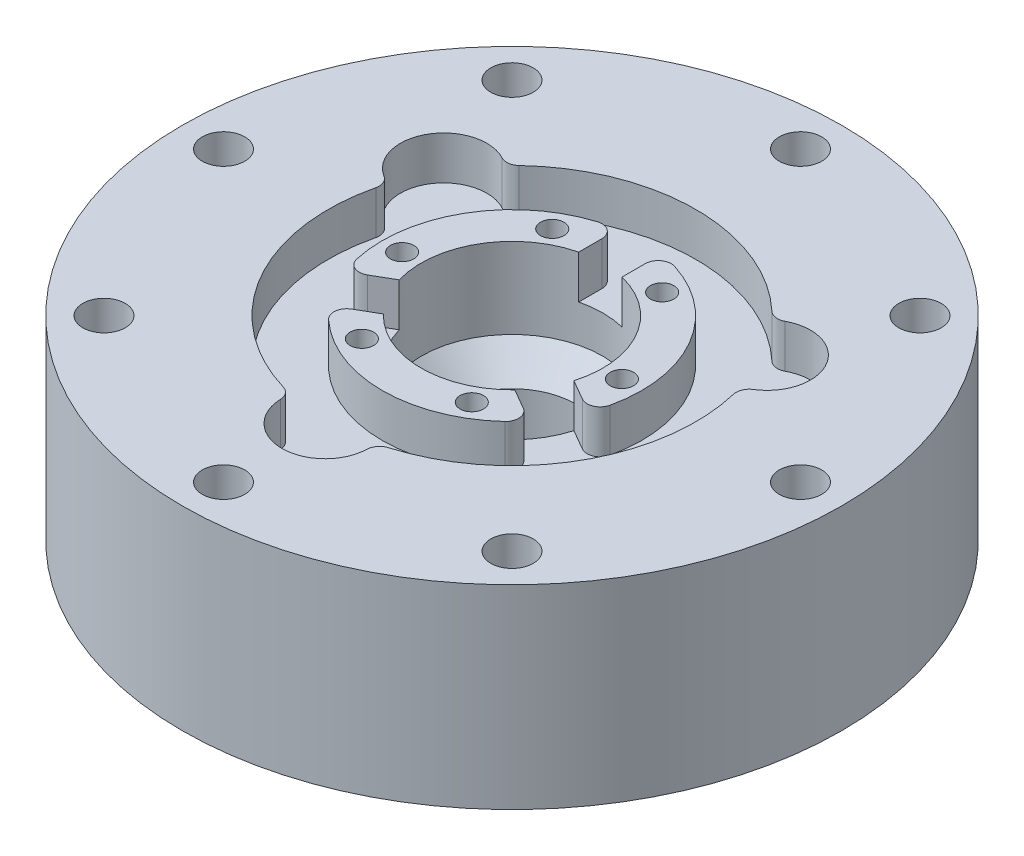
from build123d import *

# Parameters (mm, degrees)
SKETCH6_R                   = 42.5
SKETCH6_R_2                 = 29
CUT_EXTRUDE3_DEPTH          = 10
CUT_EXTRUDE4_DEPTH          = 10
CIRPATTERN2_COUNT           = 3
DELETEFACE1_START           = 15
DELETEFACE1_OUTLINE_R       = 76.2
DELETEFACE1_OUTLINE_R_2     = 55
DELETEFACE1_DEPTH           = 20
F_3_8_CLEARANCE_HOLE1_D     = 9.8044
SKETCH46_R                  = 10.000000000000007
CUT_EXTRUDE5_DEPTH          = 10
CIRPATTERN6_COUNT           = 3
SKETCH54_R                  = 57.5945
SKETCH54_R_2                = 55.56250000000001
CUT_EXTRUDE6_DEPTH          = 1.27
MOVE_START                  = 16.3599999
MOVE_FACE1_DEPTH            = 18.6400001
MOVE_FACE1_2_DEPTH          = 8.6400001
F_1_4_28_TAPPED_HOLE1_D     = 5.4102
F_1_4_28_TAPPED_HOLE1_DEPTH = 15.42
F_1_4_28_TAPPED_HOLE1_TIP   = 1.6253880605314532
FILLET2_R                   = 3


# Read off the part's stored shape, not the designer's step: DeleteFace1, Move Face1
with BuildPart() as part:
    # Sketch3 → Revolve1 (revolve)
    with BuildSketch(Plane(origin=(0, 0, 0), x_dir=(0, 0, -1), z_dir=(1, 0, 0))):
        with BuildLine():
            Line((76.2, 15.000000000000002), (55, 14.999999999999998))
            Line((55, 14.999999999999998), (55, 34.99999999999999))
            Line((55, 34.99999999999999), (22.024999999999995, 34.99999999999999))
            Line((22.024999999999995, 34.99999999999999), (22.024999999999995, 17.360000000000028))
            Line((22.024999999999995, 17.360000000000028), (14.665, 10))
            Line((14.665, 10), (14.665, 0))
            Line((14.665, 0), (19.665, 0))
            ThreePointArc((19.665, 0), (38.73875508023388, 1.7729204917795123), (53.85, -10.000000000000004))
            Line((53.85, -10.000000000000004), (76.2, -10))
            Line((76.2, -10), (76.2, 15.000000000000002))
        make_face()
    revolve(axis=Axis((0, 0, 0), (0, 1, 0)))

    # Sketch6 → Cut-Extrude3 (cut)
    with BuildSketch(Plane(origin=(0, 34.99999999999999, 0), x_dir=(1, 0, 0), z_dir=(0, 1, 0))):
        with Locations(Location((0, 0, 0), (0, 0, 270))):
            Circle(SKETCH6_R)
        with Locations(Location((0, 0, 0), (0, 0, 270))):
            Circle(SKETCH6_R_2, mode=Mode.SUBTRACT)
    extrude(amount=-CUT_EXTRUDE3_DEPTH, mode=Mode.SUBTRACT)

    # Sketch7 → Cut-Extrude4 (cut)
    with BuildSketch(Plane(origin=(0, 34.99999999999999, 0), x_dir=(1, 0, 0), z_dir=(0, 1, 0))):
        Polygon((-4.999999999999999, 29), (5.000000000000001, 29.000000000000004), (5.000000000000005, 21.44995629366177), (-5, 21.449956293661767), align=None)
    cut_extrude4 = extrude(amount=-CUT_EXTRUDE4_DEPTH, mode=Mode.SUBTRACT)

    # CirPattern2: Cut-Extrude4 ×3 about axis
    cirpattern2_axis = Axis((2.9e-16, 0, 0), (0, 1, 0))
    for i in range(1, CIRPATTERN2_COUNT):
        add(cut_extrude4.rotate(cirpattern2_axis, i * 360 / CIRPATTERN2_COUNT), mode=Mode.SUBTRACT)

    # DeleteFace1 outline → DeleteFace1 (add)
    with BuildSketch(Plane(origin=(0, 0, 0), x_dir=(1, 0, 0), z_dir=(0, 1, 0)).offset(DELETEFACE1_START)):
        Circle(DELETEFACE1_OUTLINE_R)
        Circle(DELETEFACE1_OUTLINE_R_2, mode=Mode.SUBTRACT)
    extrude(amount=DELETEFACE1_DEPTH)

    # 3/8 Clearance Hole1 (through all)
    with Locations(Plane(origin=(0, -10.000000000000002, 0), x_dir=(-1, 0, 0), z_dir=(0, -1, 0))):
        with Locations((-47.146344636, 47.146344636), (-66.675, 0), (-47.146344636, -47.146344636), (0, -66.675), (47.146344636, -47.146344636), (66.675, 0), (47.146344636, 47.146344636), (0, 66.675)):
            Hole(F_3_8_CLEARANCE_HOLE1_D / 2)

    # Sketch46 → Cut-Extrude5 (cut)
    with BuildSketch(Plane(origin=(0, 34.99999999999999, 0), x_dir=(1, 0, 0), z_dir=(0, 1, 0))):
        with Locations((0, -43.17999999999999)):
            Circle(SKETCH46_R)
    cut_extrude5 = extrude(amount=-CUT_EXTRUDE5_DEPTH, mode=Mode.SUBTRACT)

    # CirPattern6: Cut-Extrude5 ×3 about axis
    cirpattern6_axis = Axis((2.97e-15, 0, -2.87e-15), (0, 1, 0))
    for i in range(1, CIRPATTERN6_COUNT):
        add(cut_extrude5.rotate(cirpattern6_axis, i * 360 / CIRPATTERN6_COUNT), mode=Mode.SUBTRACT)

    # Sketch54 → Cut-Extrude6 (cut)
    with BuildSketch(Plane.XZ.offset(10.000000000000002)):
        with Locations(Location((1.9421e-13, 2e-17, 0), (0, 0, 270))):
            Circle(SKETCH54_R)
        with Locations(Location((1.9421e-13, 2e-17, 0), (0, 0, 270))):
            Circle(SKETCH54_R_2, mode=Mode.SUBTRACT)
    extrude(amount=-CUT_EXTRUDE6_DEPTH, mode=Mode.SUBTRACT)

    # Move Face1 outline → Move Face1 (add)
    with BuildSketch(Plane(origin=(0, 0, 0), x_dir=(1, 0, 0), z_dir=(0, 1, 0)).offset(MOVE_START)):
        with BuildLine():
            Line((27.238633754, -9.952729838), (28.117376915, -10.460072439))
            ThreePointArc((28.117376915, -10.460072439), (25.980762114, 15), (5, 29.580398915))
            Line((5, 29.580398915), (5, 28.565713714))
            ThreePointArc((5, 28.565713714), (25.11473671, 14.5), (27.238633754, -9.952729838))
        make_face()
        with BuildLine():
            Line((20.18581264, -5.88078167), (21.07620706, -6.394851128))
            ThreePointArc((21.07620706, -6.394851128), (19.074209518, 11.0125), (5, 21.449956294))
            Line((5, 21.449956294), (5, 20.421817378))
            ThreePointArc((5, 20.421817378), (18.208184115, 10.5125), (20.18581264, -5.88078167))
        make_face()
        with BuildLine():
            ThreePointArc((-16.07620706, -15.055105166), (0, -22.025), (16.07620706, -15.055105166))
            Line((16.07620706, -15.055105166), (15.18581264, -14.541035708))
            ThreePointArc((15.18581264, -14.541035708), (0, -21.025), (-15.18581264, -14.541035708))
            Line((-15.18581264, -14.541035708), (-16.07620706, -15.055105166))
        make_face()
        with BuildLine():
            Line((-5, 20.421817378), (-5, 21.449956294))
            ThreePointArc((-5, 21.449956294), (-19.074209518, 11.0125), (-21.07620706, -6.394851128))
            Line((-21.07620706, -6.394851128), (-20.18581264, -5.88078167))
            ThreePointArc((-20.18581264, -5.88078167), (-18.208184115, 10.5125), (-5, 20.421817378))
        make_face()
        with BuildLine():
            Line((23.117376915, -19.120326477), (22.238633754, -18.612983876))
            ThreePointArc((22.238633754, -18.612983876), (0, -29), (-22.238633754, -18.612983876))
            Line((-22.238633754, -18.612983876), (-23.117376915, -19.120326477))
            ThreePointArc((-23.117376915, -19.120326477), (0, -30), (23.117376915, -19.120326477))
        make_face()
        with BuildLine():
            ThreePointArc((-27.238633754, -9.952729838), (-25.11473671, 14.5), (-5, 28.565713714))
            Line((-5, 28.565713714), (-5, 29.580398915))
            ThreePointArc((-5, 29.580398915), (-25.980762114, 15), (-28.117376915, -10.460072439))
            Line((-28.117376915, -10.460072439), (-27.238633754, -9.952729838))
        make_face()
    extrude(amount=MOVE_FACE1_DEPTH)

    # Move Face1 2 outline → Move Face1 2 (add)
    with BuildSketch(Plane(origin=(0, 0, 0), x_dir=(1, 0, 0), z_dir=(0, 1, 0)).offset(MOVE_START)):
        with BuildLine():
            ThreePointArc((16.07620706, -15.055105166), (19.074209518, -11.0125), (21.07620706, -6.394851128))
            Line((21.07620706, -6.394851128), (20.18581264, -5.88078167))
            ThreePointArc((20.18581264, -5.88078167), (18.208184114, -10.5125), (15.18581264, -14.541035708))
            Line((15.18581264, -14.541035708), (16.07620706, -15.055105166))
        make_face()
        with BuildLine():
            Line((5, 20.421817378), (5, 21.449956294))
            ThreePointArc((5, 21.449956294), (0, 22.025), (-5, 21.449956294))
            Line((-5, 21.449956294), (-5, 20.421817378))
            ThreePointArc((-5, 20.421817378), (0, 21.025), (5, 20.421817378))
        make_face()
        with BuildLine():
            ThreePointArc((-21.07620706, -6.394851128), (-19.074209518, -11.0125), (-16.07620706, -15.055105166))
            Line((-16.07620706, -15.055105166), (-15.18581264, -14.541035708))
            ThreePointArc((-15.18581264, -14.541035708), (-18.208184114, -10.5125), (-20.18581264, -5.88078167))
            Line((-20.18581264, -5.88078167), (-21.07620706, -6.394851128))
        make_face()
    extrude(amount=MOVE_FACE1_2_DEPTH)

    # 1/4-28 Tapped Hole1
    with Locations(Plane(origin=(0, 34.99999999999999, 0), x_dir=(1, 0, 0), z_dir=(0, 1, 0))):
        with Locations((12.7, -21.997045256), (25.4, 0), (12.7, 21.997045256), (-12.7, 21.997045256), (-25.4, 0), (-12.7, -21.997045256)):
            Hole(F_1_4_28_TAPPED_HOLE1_D / 2, depth=F_1_4_28_TAPPED_HOLE1_DEPTH)
            with Locations((0, 0, -(F_1_4_28_TAPPED_HOLE1_DEPTH + F_1_4_28_TAPPED_HOLE1_TIP / 2))):  # 118° drill point
                Cone(0, F_1_4_28_TAPPED_HOLE1_D / 2, F_1_4_28_TAPPED_HOLE1_TIP, mode=Mode.SUBTRACT)

    # Fillet2
    # the kernel refuses this fillet: 3 mm, written as the material it takes off along each edge
    with BuildSketch(Plane(origin=(9.830646823307555, 24.999999999999993, 41.34741083835109), x_dir=(0.9660012872655641, 0, -0.2585372565052729), z_dir=(0, 1, 0))) as fillet2_piece_1:
        with BuildLine():
            CenterArc((2.4710993757232056, -2.99881698030462), FILLET2_R, 91.60911566596931, 71.53236669555653)
            ThreePointArc((-0.399972032548426, -2.1287888378832687), (-0.1421780421624502, -1.075255793490215), (0, 0))
            ThreePointArc((0, 0), (1.193428675775411, -0.0167594456845017), (2.386857351550826, 1e-16))
        make_face()
    extrude(amount=15.967143378877061, mode=Mode.SUBTRACT)
    with BuildSketch(Plane(origin=(-9.830646823307555, 24.999999999999993, 41.34741083835109), x_dir=(-0.9660012872655644, 0, -0.2585372565052715), z_dir=(0, 1, 0))) as fillet2_piece_2:
        with BuildLine():
            CenterArc((2.471099375723227, 2.9988169803046207), FILLET2_R, 196.85851763847407, 71.53236669555645)
            ThreePointArc((-0.3999720325484057, 2.1287888378832736), (-0.14217804216245042, 1.075255793490222), (0, 0))
            ThreePointArc((0, 0), (1.1934286757754193, 0.01675944568450221), (2.386857351550839, 2e-17))
        make_face()
    extrude(amount=15.967143378877097, mode=Mode.SUBTRACT)
    with BuildSketch(Plane(origin=(30.892584755070303, 24.999999999999993, -29.18729530379268), x_dir=(0.8256829754273846, 0, -0.5641344025047409), z_dir=(0, 1, 0))) as fillet2_piece_3:
        with BuildLine():
            CenterArc((2.490943414807226, 2.9823541557433946), FILLET2_R, 192.25019723269426, 71.53236669558856)
            ThreePointArc((-0.4407477133877039, 2.345811047334284), (-0.20390261981452568, 1.1760002571493982), (0, 0))
            ThreePointArc((0, 0), (1.0830188760031507, 0.05881948085535766), (2.1660377520062934, -7e-17))
        make_face()
    extrude(amount=15.967143378876976, mode=Mode.SUBTRACT)
    with BuildSketch(Plane(origin=(40.72323157837786, 24.999999999999993, -12.160115534558376), x_dir=(0.25910081167448135, 0, 0.9658502831130842), z_dir=(0, 1, 0))) as fillet2_piece_4:
        with BuildLine():
            CenterArc((2.471099375723175, 2.998816980304626), FILLET2_R, 196.85851763847427, 71.53236669555645)
            ThreePointArc((-0.39997203254845776, 2.1287888378832673), (-0.14217804216247343, 1.0752557934902138), (0, 0))
            ThreePointArc((0, 0), (1.1934286757754016, 0.01675944568450463), (2.3868573515507956, -2e-17))
        make_face()
    extrude(amount=15.96714337887699, mode=Mode.SUBTRACT)
    with BuildSketch(Plane(origin=(-40.72323157837785, 24.999999999999993, -12.160115534558436), x_dir=(-0.9013962114315556, 0, -0.43299523094006276), z_dir=(0, 1, 0))) as fillet2_piece_5:
        with BuildLine():
            CenterArc((2.49094341480725, 2.982354155743391), FILLET2_R, 192.2501972326937, 71.53236669558873)
            ThreePointArc((-0.4407477133876857, 2.3458110473343083), (-0.20390261981451535, 1.1760002571494013), (0, 0))
            ThreePointArc((0, 0), (1.0830188760031414, 0.0588194808553639), (2.1660377520062966, -6e-17))
        make_face()
    extrude(amount=15.967143378877033, mode=Mode.SUBTRACT)
    with BuildSketch(Plane(origin=(-30.892584755070274, 24.999999999999993, -29.187295303792705), x_dir=(0.7069004755910809, 0, -0.7073130266078123), z_dir=(0, 1, 0))) as fillet2_piece_6:
        with BuildLine():
            CenterArc((2.4710993757232096, 2.9988169803046243), FILLET2_R, 196.85851763847404, 71.53236669555645)
            ThreePointArc((-0.3999720325484262, 2.1287888378832767), (-0.14217804216245522, 1.0752557934902165), (0, 0))
            ThreePointArc((0, 0), (1.1934286757754182, 0.01675944568449942), (2.3868573515508196, -1.8e-16))
        make_face()
    extrude(amount=15.967143378877047, mode=Mode.SUBTRACT)
    with BuildSketch(Plane(origin=(5.000000000000002, 24.999999999999993, -29.580398915), x_dir=(0.9727164823489909, 0, 0.2319970796510279), z_dir=(0, 1, 0))) as fillet2_piece_7:
        with BuildLine():
            CenterArc((3.7980691304680256, -2.9933326977725025), FILLET2_R, 86.17939148491388, 107.23528525435825)
            Line((0.879919683421053, -3.6893239367255863), (0, 0))
            ThreePointArc((0, 0), (1.9989837528820262, 0.06667302227236113), (3.997967505764053, -4e-17))
        make_face()
    extrude(amount=19.994918764410137, mode=Mode.SUBTRACT)
    with BuildSketch(Plane(origin=(-5, 24.999999999999993, -29.580398915000004), x_dir=(0, 0, 1), z_dir=(0, 1, 0))) as fillet2_piece_8:
        with BuildLine():
            CenterArc((3.7928049988587844, -3), FILLET2_R, 90, 107.23528525435827)
            ThreePointArc((0.9275167858769642, -3.888888888752385), (0.398904445246135, -1.9599123908348863), (0, 0))
            Line((0, 0), (3.7928049988587844, 0))
        make_face()
    extrude(amount=19.99491876441016, mode=Mode.SUBTRACT)
    with BuildSketch(Plane(origin=(28.117376915, 24.999999999999993, 10.460072439), x_dir=(-0.8660254035932116, 0, -0.500000000331215), z_dir=(0, 1, 0))) as fillet2_piece_9:
        with BuildLine():
            CenterArc((3.7928050005013083, -2.9999999999999996), FILLET2_R, 90.00000000000003, 107.23528528020469)
            ThreePointArc((0.927516787920472, -3.8888888900449325), (0.39890444621818144, -1.959912391521957), (0, 0))
            Line((0, 0), (3.7928050005013074, 8e-17))
        make_face()
    extrude(amount=19.99491876873858, mode=Mode.SUBTRACT)
    with BuildSketch(Plane(origin=(23.117376915000005, 24.999999999999993, 19.120326477), x_dir=(-0.6872736057892516, 0, 0.7263986445371717), z_dir=(0, 1, 0))) as fillet2_piece_10:
        with BuildLine():
            CenterArc((3.798069129156114, -2.9933326977780332), FILLET2_R, 86.17939148649958, 107.2352852334754)
            Line((0.8799196818747332, -3.689323935748289), (0, 0))
            ThreePointArc((0, 0), (1.9989837521846505, 0.06667302222141196), (3.997967504369298, 1.1e-16))
        make_face()
    extrude(amount=19.994918760923248, mode=Mode.SUBTRACT)
    with BuildSketch(Plane(origin=(-23.117376915, 24.999999999999993, 19.120326477000003), x_dir=(0.8660254035932119, 0, -0.5000000003312144), z_dir=(0, 1, 0))) as fillet2_piece_11:
        with BuildLine():
            CenterArc((3.7928049975494087, -3.0000000000000004), FILLET2_R, 89.99999999999994, 107.23528523347551)
            ThreePointArc((0.9275167842436107, -3.888888887708064), (0.3989044444738124, -1.959912390279063), (0, 0))
            Line((0, 0), (3.7928049975494114, 3.1e-16))
        make_face()
    extrude(amount=19.994918760923248, mode=Mode.SUBTRACT)
    with BuildSketch(Plane(origin=(-28.117376915, 24.999999999999993, 10.460072438999998), x_dir=(-0.28544287655482414, 0, -0.9583957242309189), z_dir=(0, 1, 0))) as fillet2_piece_12:
        with BuildLine():
            CenterArc((3.798069132112833, -2.993332697766721), FILLET2_R, 86.17939148325686, 107.23528528020466)
            Line((0.8799196853596981, -3.6893239379518032), (0, 0))
            ThreePointArc((0, 0), (1.9989837537477129, 0.06667302233017942), (3.997967507495428, 8e-17))
        make_face()
    extrude(amount=19.99491876873858, mode=Mode.SUBTRACT)


solid = part.part
